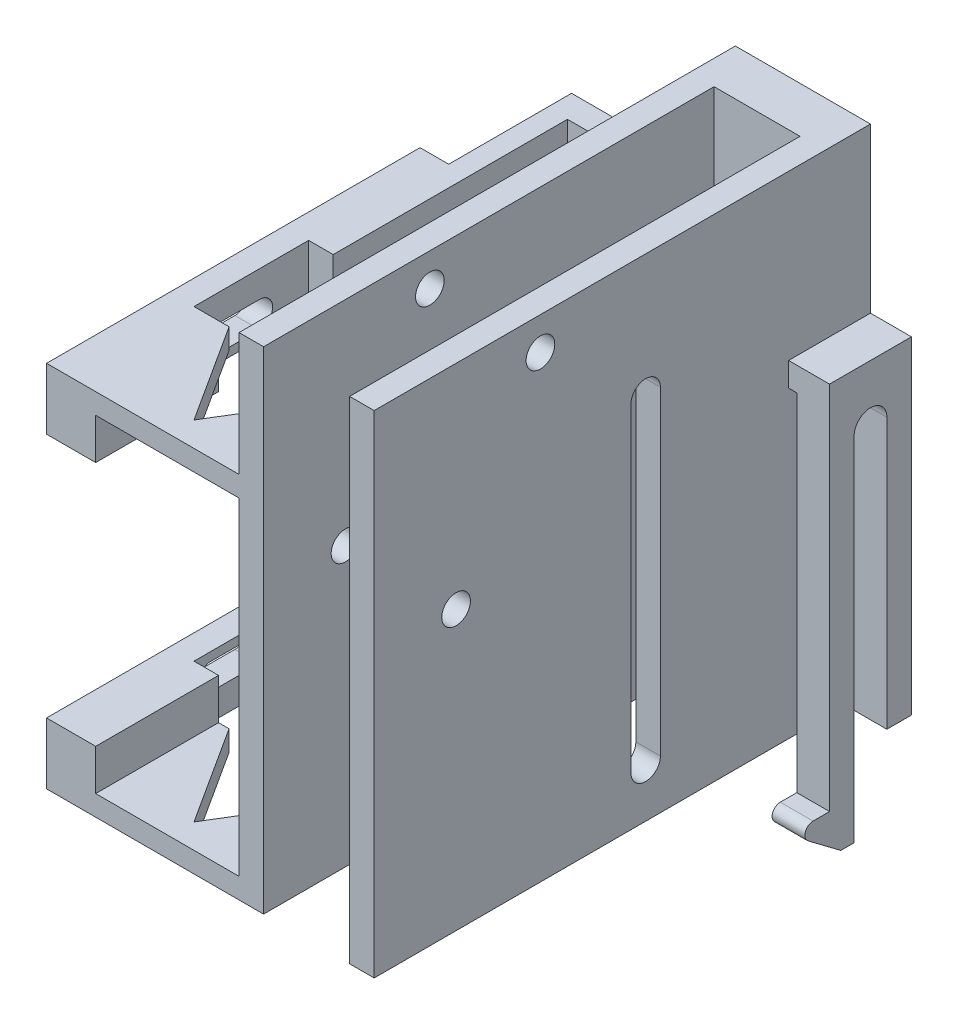
from build123d import *

# Parameters (mm, degrees)
CUT_EXTRUDE1_START             = -55
CUT_EXTRUDE1_DEPTH             = 50.2
CUT_EXTRUDE1_2_DEPTH           = 39
CUT_EXTRUDE1_START_2           = -16
CUT_EXTRUDE1_3_OUTLINE_W       = 21.5
CUT_EXTRUDE1_3_OUTLINE_H       = 4
CUT_EXTRUDE1_3_OUTLINE_W_2     = 7.5
CUT_EXTRUDE1_3_DEPTH           = 6
CUT_EXTRUDE1_START_3           = -10
CUT_EXTRUDE1_4_OUTLINE_W       = 17.5
CUT_EXTRUDE1_4_OUTLINE_H       = 3
CUT_EXTRUDE1_4_DEPTH           = 6.998889459
CUT_EXTRUDE1_START_4           = -32.686984715
CUT_EXTRUDE1_5_DEPTH           = 2.5
CUT_EXTRUDE1_START_5           = -25
CUT_EXTRUDE1_6_DEPTH           = 46.5
CUT_EXTRUDE2_DEPTH             = 5.2
CUT_EXTRUDE3_DEPTH             = 40
CUT_EXTRUDE4_DEPTH             = 38.5
CUT_EXTRUDE5_DEPTH             = 4
CUT_EXTRUDE6_DEPTH             = 4
CUT_EXTRUDE7_DEPTH             = 4
CUT_EXTRUDE8_START             = -4
CUT_EXTRUDE8_DEPTH             = 4
CUT_EXTRUDE9_START             = -1
CUT_EXTRUDE9_DEPTH             = 1
CUT_EXTRUDE10_DEPTH            = 1
SKETCH11_W                     = 16.5
SKETCH11_H                     = 60.6
BOSS_EXTRUDE1_DEPTH            = 15
SKETCH12_W                     = 29
SKETCH12_H                     = 30
CUT_EXTRUDE11_DEPTH            = 84.339300358
SKETCH13_W                     = 10.5
SKETCH13_H                     = 55
CUT_EXTRUDE12_DEPTH            = 82.199993727
CUT_EXTRUDE15_DEPTH            = 84.106491828
CUT_EXTRUDE16_REACH            = 80.794
BOSS_EXTRUDE2_DEPTH            = 10.5
F_3_5_3_5_DIAMETER_HOLE1_D     = 3.5
F_3_5_3_5_DIAMETER_HOLE1_DEPTH = 3
F_3_5_3_5_DIAMETER_HOLE2_D     = 3.5
F_3_5_3_5_DIAMETER_HOLE2_DEPTH = 8
SKETCH24_W                     = 46.5
SKETCH24_H                     = 16
CUT_EXTRUDE17_DEPTH            = 3
SKETCH25_W                     = 3
SKETCH25_H                     = 6
BOSS_EXTRUDE4_DEPTH            = 46.5
SKETCH27_W                     = 45.6
SKETCH27_H                     = 7.5
BOSS_EXTRUDE5_DEPTH            = 3.5
CUT_EXTRUDE18_START            = -45
SKETCH28_W                     = 4.285714286
SKETCH28_H                     = 14
CUT_EXTRUDE18_DEPTH            = 45


with BuildPart() as part:
    # Cut-Extrude1: read off the stored shape, not the designer's step
    # Cut-Extrude1 outline → Cut-Extrude1 (new body)
    with BuildSketch(Plane.XZ.offset(66).offset(CUT_EXTRUDE1_START)):
        Polygon((0, 10.913015285), (0, -25.686984715), (21.5, -25.686984715), (21.5, 27.913015285), (-25, 27.913015285), (-25, -25.686984715), (-17.5, -25.686984715), (-17.5, 10.913015285), (-8.5, 24.913015285), align=None)
    extrude(amount=CUT_EXTRUDE1_DEPTH)

    # Cut-Extrude1 2 outline → Cut-Extrude1 2 (add)
    with BuildSketch(Plane.XZ.offset(66).offset(CUT_EXTRUDE1_START)):
        Polygon((21.5, -25.686984715), (0, -25.686984715), (0, -29.686984715), (-17.5, -29.686984715), (-17.5, -25.686984715), (-25, -25.686984715), (-25, -32.686984715), (21.5, -32.686984715), align=None)
    extrude(amount=CUT_EXTRUDE1_2_DEPTH)

    # Cut-Extrude1 3 outline → Cut-Extrude1 3 (add)
    with BuildSketch(Plane.XZ.offset(66).offset(CUT_EXTRUDE1_START_2)):
        with Locations((10.75, -27.686984715)):
            Rectangle(CUT_EXTRUDE1_3_OUTLINE_W, CUT_EXTRUDE1_3_OUTLINE_H)
        with Locations((-21.25, -27.686984715)):
            Rectangle(CUT_EXTRUDE1_3_OUTLINE_W_2, CUT_EXTRUDE1_3_OUTLINE_H)
    extrude(amount=CUT_EXTRUDE1_3_DEPTH)

    # Cut-Extrude1 4 outline → Cut-Extrude1 4 (add)
    with BuildSketch(Plane.XZ.offset(66).offset(CUT_EXTRUDE1_START_3)):
        with Locations((-8.75, -24.186984715)):
            Rectangle(CUT_EXTRUDE1_4_OUTLINE_W, CUT_EXTRUDE1_4_OUTLINE_H)
    extrude(amount=CUT_EXTRUDE1_4_DEPTH)

    # Cut-Extrude1 5 outline → Cut-Extrude1 5 (add)
    with BuildSketch(Plane.XY.offset(CUT_EXTRUDE1_START_4)):
        with BuildLine():
            Line((21.5, -50), (20, -50))
            add(Edge.make_bspline(
                [(20, -50), (20, -56.474665919), (-1.75, -56.474665919), (-23.5, -56.474665919), (-23.5, -50)],
                knots=[3.141592654, 3.141592654, 3.141592654, 4.71238898, 4.71238898, 6.283185307, 6.283185307, 6.283185307], degree=2, weights=[1, 0.707106781, 1, 0.707106781, 1]))
            Line((-23.5, -50), (-25, -50))
            add(Edge.make_bspline(
                [(21.5, -50), (21.5, -50.09468229), (21.492127929, -50.284046871), (21.445455232, -50.658803427), (21.331279759, -51.114385581), (21.116585857, -51.62790352), (20.837225059, -52.104092778), (20.503510106, -52.544605667), (19.994946462, -53.090128019), (19.250040532, -53.706208194), (18.455849001, -54.204954404), (17.874413136, -54.519485832), (17.472964493, -54.724490985), (16.947888344, -54.97109157), (16.28060453, -55.252861877), (15.342350204, -55.610435464), (14.08020873, -56.024524848), (12.704647903, -56.395626222), (11.540151261, -56.666305963), (10.635775953, -56.85602278), (9.857415835, -57.002816928), (9.220023976, -57.113406891), (8.575249929, -57.219018373), (7.756242667, -57.341650868), (6.420129281, -57.517794074), (4.706083352, -57.700164474), (2.944949539, -57.831502083), (1.514762167, -57.90548411), (0.433251397, -57.945296373), (-0.473981522, -57.965298566), (-1.2023611, -57.973324155), (-1.75, -57.975336801), (-2.2976389, -57.973324155), (-3.026018478, -57.965298566), (-3.933251397, -57.945296373), (-5.014762167, -57.90548411), (-6.444949539, -57.831502083), (-8.206083352, -57.700164474), (-9.920129281, -57.517794074), (-11.256242667, -57.341650868), (-12.075249929, -57.219018373), (-12.720023976, -57.113406891), (-13.357415835, -57.002816928), (-14.135775953, -56.85602278), (-15.040151261, -56.666305963), (-16.204647903, -56.395626222), (-17.58020873, -56.024524848), (-18.842350204, -55.610435464), (-19.78060453, -55.252861877), (-20.447888344, -54.97109157), (-20.972964493, -54.724490985), (-21.374413136, -54.519485832), (-21.955849001, -54.204954404), (-22.750040532, -53.706208194), (-23.494946462, -53.090128019), (-24.003510106, -52.544605667), (-24.337225059, -52.104092778), (-24.616585857, -51.62790352), (-24.831279759, -51.114385581), (-24.945455232, -50.658803427), (-24.992127929, -50.284046871), (-25, -50.09468229), (-25, -50)],
                knots=[0.5, 0.5, 0.5, 0.5, 0.50390625, 0.5078125, 0.515625, 0.5234375, 0.53125, 0.5390625, 0.546875, 0.5625, 0.578125, 0.58203125, 0.5859375, 0.59375, 0.6015625, 0.609375, 0.625, 0.640625, 0.6484375, 0.65625, 0.6640625, 0.66796875, 0.671875, 0.6796875, 0.6875, 0.703125, 0.71875, 0.7265625, 0.734375, 0.7421875, 0.74609375, 0.75, 0.75390625, 0.7578125, 0.765625, 0.7734375, 0.78125, 0.796875, 0.8125, 0.8203125, 0.828125, 0.83203125, 0.8359375, 0.84375, 0.8515625, 0.859375, 0.875, 0.890625, 0.8984375, 0.90625, 0.9140625, 0.91796875, 0.921875, 0.9375, 0.953125, 0.9609375, 0.96875, 0.9765625, 0.984375, 0.9921875, 0.99609375, 1, 1, 1, 1], degree=3))
        make_face()
    extrude(amount=CUT_EXTRUDE1_5_DEPTH)

    # Cut-Extrude1 6 outline → Cut-Extrude1 6 (add)
    with BuildSketch(Plane.YZ.offset(CUT_EXTRUDE1_START_5)):
        with BuildLine():
            ThreePointArc((-61.2, -20.677767147), (-61.882895489, -19.729376547), (-62.998889459, -20.076289273))
            Line((-62.998889459, -20.076289273), (-66, -24.062396958))
            Line((-66, -24.062396958), (-66, -25.686984715))
            Line((-66, -25.686984715), (-61.2, -25.686984715))
            Line((-61.2, -25.686984715), (-61.2, -20.677767147))
        make_face()
    extrude(amount=CUT_EXTRUDE1_6_DEPTH)

    # Sketch2 → Cut-Extrude2 (cut)
    with BuildSketch(Plane.XZ.offset(61.2)):
        Polygon((-25, -22.686984715), (-17.5, -22.686984715), (-17.5, 10.913015285), (-8.5, 24.913015285), (0, 10.913015285), (0, -22.686984715), (21.5, -22.686984715), (21.5, 27.913015285), (-25, 27.913015285), align=None)
    extrude(amount=-CUT_EXTRUDE2_DEPTH, mode=Mode.SUBTRACT)

    # Sketch3 → Cut-Extrude3 (cut)
    with BuildSketch(Plane(origin=(0, -13.5, 0), x_dir=(1, 0, 0), z_dir=(0, 1, 0))):
        Polygon((-8.5, -24.913015285), (-17.5, -10.913015285), (-17.5, -27.913015285), (0, -27.913015285), (0, -10.913015285), align=None)
    extrude(amount=-CUT_EXTRUDE3_DEPTH, mode=Mode.SUBTRACT)

    # Sketch4 → Cut-Extrude4 (cut)
    with BuildSketch(Plane(origin=(-21, 0, 0), x_dir=(0, -1, 0), z_dir=(-1, 0, 0))):
        with BuildLine():
            Line((56, -22.686984715), (56, -25.686984715))
            Line((56, -25.686984715), (66, -25.686984715))
            Line((66, -25.686984715), (66, -24.062396958))
            Line((66, -24.062396958), (62.998889459, -20.076289273))
            ThreePointArc((62.998889459, -20.076289273), (61.882895489, -19.729376547), (61.2, -20.677767147))
            Line((61.2, -20.677767147), (61.2, -22.686984715))
            Line((61.2, -22.686984715), (56, -22.686984715))
        make_face()
    extrude(amount=-CUT_EXTRUDE4_DEPTH, mode=Mode.SUBTRACT)

    # Sketch5 → Cut-Extrude5 (cut)
    with BuildSketch(Plane.ZY.offset(25)):
        Polygon((-22.686984715, -16), (-22.686984715, -56), (27.913015285, -56), (27.913015285, -11), (-32.686984715, -11), (-32.686984715, -16), align=None)
    extrude(amount=-CUT_EXTRUDE5_DEPTH, mode=Mode.SUBTRACT)

    # Sketch6 → Cut-Extrude6 (cut)
    with BuildSketch(Plane.ZY.offset(25)):
        with BuildLine():
            Line((-29.686984715, -23), (-29.686984715, -50))
            Line((-29.686984715, -50), (-29.686984715, -56))
            Line((-29.686984715, -56), (-25.686984715, -56))
            Line((-25.686984715, -56), (-25.686984715, -23))
            ThreePointArc((-25.686984715, -23), (-27.686984715, -21), (-29.686984715, -23))
        make_face()
    extrude(amount=-CUT_EXTRUDE6_DEPTH, mode=Mode.SUBTRACT)

    # Sketch7 → Cut-Extrude7 (cut)
    with BuildSketch(Plane(origin=(21.5, 0, 0), x_dir=(0, 0, -1), z_dir=(1, 0, 0))):
        Polygon((-27.913015285, -56), (22.686984715, -56), (22.686984715, -16), (32.686984715, -16), (32.686984715, -11), (-27.913015285, -11), align=None)
    extrude(amount=-CUT_EXTRUDE7_DEPTH, mode=Mode.SUBTRACT)

    # Sketch8 → Cut-Extrude8 (cut)
    with BuildSketch(Plane(origin=(21.5, 0, 0), x_dir=(0, 0, -1), z_dir=(1, 0, 0)).offset(CUT_EXTRUDE8_START)):
        with BuildLine():
            Line((25.686984715, -23), (25.686984715, -56))
            Line((25.686984715, -56), (29.686984715, -56))
            Line((29.686984715, -56), (29.686984715, -50))
            Line((29.686984715, -50), (29.686984715, -23))
            ThreePointArc((29.686984715, -23), (27.686984715, -21), (25.686984715, -23))
        make_face()
    extrude(amount=CUT_EXTRUDE8_DEPTH, mode=Mode.SUBTRACT)

    # Sketch9 → Cut-Extrude9 (cut)
    with BuildSketch(Plane(origin=(17.5, 0, 0), x_dir=(0, 0, -1), z_dir=(1, 0, 0)).offset(CUT_EXTRUDE9_START)):
        with BuildLine():
            Line((32.686984715, -16), (32.686984715, -11))
            Line((32.686984715, -11), (-27.913015285, -11))
            Line((-27.913015285, -11), (-27.913015285, -56))
            Line((-27.913015285, -56), (29.686984715, -56))
            Line((29.686984715, -56), (29.686984715, -50))
            Line((29.686984715, -50), (29.686984715, -23))
            ThreePointArc((29.686984715, -23), (28.911729586, -21.41886117), (27.186984715, -21.063508327))
            Line((27.186984715, -21.063508327), (27.186984715, -18.926625782))
            Line((27.186984715, -18.926625782), (22.686984715, -18.926625782))
            Line((22.686984715, -18.926625782), (22.686984715, -16))
            Line((22.686984715, -16), (32.686984715, -16))
        make_face()
    extrude(amount=CUT_EXTRUDE9_DEPTH, mode=Mode.SUBTRACT)

    # Sketch10 → Cut-Extrude10 (cut)
    with BuildSketch(Plane.ZY.offset(21)):
        with BuildLine():
            Line((27.913015285, -56), (27.913015285, -11))
            Line((27.913015285, -11), (-32.686984715, -11))
            Line((-32.686984715, -11), (-32.686984715, -16))
            Line((-32.686984715, -16), (-22.686984715, -16))
            Line((-22.686984715, -16), (-22.686984715, -19.368227571))
            Line((-22.686984715, -19.368227571), (-28.196984715, -19.368227571))
            Line((-28.196984715, -19.368227571), (-28.196984715, -21.066117894))
            ThreePointArc((-28.196984715, -21.066117894), (-29.271282666, -21.779344438), (-29.686984715, -23))
            Line((-29.686984715, -23), (-29.686984715, -50))
            Line((-29.686984715, -50), (-29.686984715, -56))
            Line((-29.686984715, -56), (27.913015285, -56))
        make_face()
    extrude(amount=-CUT_EXTRUDE10_DEPTH, mode=Mode.SUBTRACT)

    # Sketch11 → Boss-Extrude1 (add)
    with BuildSketch(Plane(origin=(0, -11, 0), x_dir=(-1, 0, 0), z_dir=(0, 1, 0))):
        with Locations((-8.25, -2.386984715)):
            Rectangle(SKETCH11_W, SKETCH11_H)
    extrude(amount=BOSS_EXTRUDE1_DEPTH)

    # Sketch12 → Cut-Extrude11 (cut, through all)
    with BuildSketch(Plane(origin=(-17.5, 0, 0), x_dir=(0, 0, -1), z_dir=(1, 0, 0))):
        with Locations((-13.413015285, -33.5)):
            Rectangle(SKETCH12_W, SKETCH12_H)
        with BuildLine():
            Line((-10.913015285, -14.25), (-4.913015285, -14.25))
            ThreePointArc((-4.913015285, -14.25), (-3.313015285, -15.85), (-4.913015285, -17.45))
            Line((-4.913015285, -17.45), (-10.913015285, -17.45))
            ThreePointArc((-10.913015285, -17.45), (-12.513015285, -15.85), (-10.913015285, -14.25))
        make_face()
        with BuildLine():
            Line((-10.913015285, -49.55), (-4.913015285, -49.55))
            ThreePointArc((-4.913015285, -49.55), (-3.313015285, -51.15), (-4.913015285, -52.75))
            Line((-4.913015285, -52.75), (-10.913015285, -52.75))
            ThreePointArc((-10.913015285, -52.75), (-12.513015285, -51.15), (-10.913015285, -49.55))
        make_face()
    extrude(amount=-CUT_EXTRUDE11_DEPTH, mode=Mode.SUBTRACT)

    # Sketch13 → Cut-Extrude12 (cut, through all)
    with BuildSketch(Plane(origin=(0, 4, 0), x_dir=(-1, 0, 0), z_dir=(0, 1, 0))):
        with Locations((-8.25, 0.413015285)):
            Rectangle(SKETCH13_W, SKETCH13_H)
    extrude(amount=-CUT_EXTRUDE12_DEPTH, mode=Mode.SUBTRACT)

    # Sketch16 → Cut-Extrude15 (cut, through all)
    with BuildSketch(Plane.ZY.offset(-13.5)):
        with BuildLine():
            Line((-3.436984715, -50), (-3.436984715, -11))
            ThreePointArc((-3.436984715, -11), (-5.236984715, -9.2), (-7.036984715, -11))
            Line((-7.036984715, -11), (-7.036984715, -50))
            ThreePointArc((-7.036984715, -50), (-5.236984715, -51.8), (-3.436984715, -50))
        make_face()
    extrude(amount=-CUT_EXTRUDE15_DEPTH, mode=Mode.SUBTRACT)

    # Sketch17 → Cut-Extrude16 (cut, up to next)
    with BuildSketch(Plane(origin=(3, 0, 0), x_dir=(0, 0, -1), z_dir=(1, 0, 0)), mode=Mode.PRIVATE) as cut_extrude16_sk1:
        with BuildLine():
            Line((7.036984715, -50), (7.036984715, -11))
            ThreePointArc((7.036984715, -11), (5.236984715, -9.2), (3.436984715, -11))
            Line((3.436984715, -11), (3.436984715, -50))
            ThreePointArc((3.436984715, -50), (5.236984715, -51.8), (7.036984715, -50))
        make_face()
    cut_extrude16_tool1 = extrude(cut_extrude16_sk1.sketch, amount=-CUT_EXTRUDE16_REACH, mode=Mode.PRIVATE) & part.part
    add(cut_extrude16_tool1.solids().sort_by_distance((3, -30.5, -5.236985))[0], mode=Mode.SUBTRACT)

    # Sketch18 → Boss-Extrude2 (add)
    with BuildSketch(Plane(origin=(3, 0, 0), x_dir=(0, 0, -1), z_dir=(1, 0, 0))):
        Polygon((-0.913015285, -22), (-0.913015285, -11.980442449), (0.986984715, -11.980442449), (0.986984715, -16.440355157), (0.286984715, -22), align=None)
    extrude(amount=BOSS_EXTRUDE2_DEPTH)

    # Ø3.5 (3.5) Diameter Hole1
    with Locations(Plane.ZY):
        with Locations((7.613015285, 0), (17.913015285, -22)):
            Hole(F_3_5_3_5_DIAMETER_HOLE1_D / 2, depth=F_3_5_3_5_DIAMETER_HOLE1_DEPTH)

    # Ø3.5 (3.5) Diameter Hole2
    with Locations(Plane.ZY.offset(-13.5)):
        with Locations((7.613015285, 0), (17.913015285, -22)):
            Hole(F_3_5_3_5_DIAMETER_HOLE2_D / 2, depth=F_3_5_3_5_DIAMETER_HOLE2_DEPTH)

    # Sketch24 → Cut-Extrude17 (cut)
    with BuildSketch(Plane(origin=(0, 0, -32.686984715), x_dir=(-1, 0, 0), z_dir=(0, 0, -1))):
        with Locations((1.75, -58)):
            Rectangle(SKETCH24_W, SKETCH24_H)
    extrude(amount=-CUT_EXTRUDE17_DEPTH, mode=Mode.SUBTRACT)

    # Sketch25 → Boss-Extrude4 (add)
    with BuildSketch(Plane.ZY.offset(25)):
        with Locations((-31.186984715, -53)):
            Rectangle(SKETCH25_W, SKETCH25_H)
    extrude(amount=-BOSS_EXTRUDE4_DEPTH)

    # Sketch27 → Boss-Extrude5 (add)
    # profile 1 of 2: a face of its own
    with BuildSketch(Plane.ZY.offset(20)):
        with Locations((5.113015285, -14.75)):
            Rectangle(SKETCH27_W, SKETCH27_H)
        with BuildLine():
            Line((10.913015285, -17.45), (4.913015285, -17.45))
            ThreePointArc((4.913015285, -17.45), (3.313015285, -15.85), (4.913015285, -14.25))
            Line((4.913015285, -14.25), (10.913015285, -14.25))
            ThreePointArc((10.913015285, -14.25), (12.513015285, -15.85), (10.913015285, -17.45))
        make_face(mode=Mode.SUBTRACT)
    # profile 2 of 2: a face of its own
    with BuildSketch(Plane.ZY.offset(20)):
        with Locations((5.113015285, -52.25)):
            Rectangle(SKETCH27_W, SKETCH27_H)
        with BuildLine():
            Line((10.913015285, -52.75), (4.913015285, -52.75))
            ThreePointArc((4.913015285, -52.75), (3.313015285, -51.15), (4.913015285, -49.55))
            Line((4.913015285, -49.55), (10.913015285, -49.55))
            ThreePointArc((10.913015285, -49.55), (12.513015285, -51.15), (10.913015285, -52.75))
        make_face(mode=Mode.SUBTRACT)
    extrude(amount=BOSS_EXTRUDE5_DEPTH)

    # Sketch28 → Cut-Extrude18 (cut)
    with BuildSketch(Plane(origin=(0, -11, 0), x_dir=(1, 0, 0), z_dir=(0, 1, 0)).offset(CUT_EXTRUDE18_START)):
        with Locations((-18.357142857, -5.913015285)):
            Rectangle(SKETCH28_W, SKETCH28_H)
    extrude(amount=CUT_EXTRUDE18_DEPTH, mode=Mode.SUBTRACT)


solid = part.part
